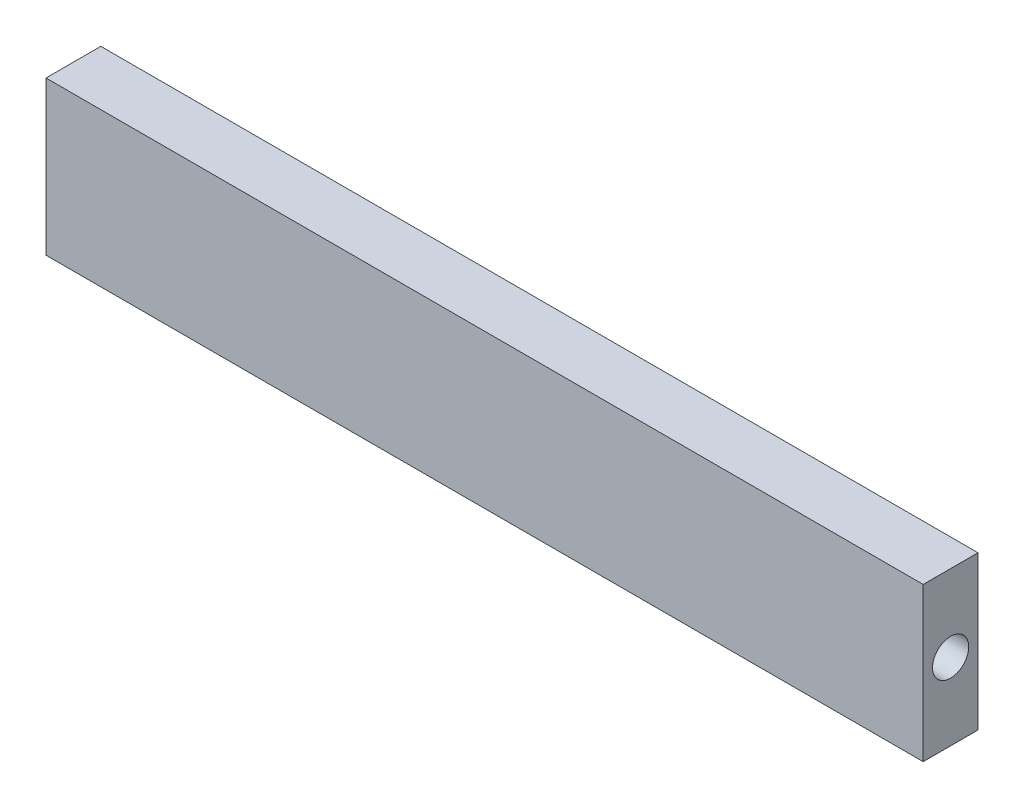
from build123d import *

# Parameters (mm, degrees)
SKETCH_1_W          = 400
SKETCH_1_H          = 70
EXTRUDE_1_DEPTH     = 25
SKETCH_2_R          = 8.25
CUT_EXTRUDE_1_DEPTH = 15
THREAD_1_PITCH      = 1.058333333
SKETCH_9_R          = 6
CUT_EXTRUDE_2_DEPTH = 15
CUT_EXTRUDE_START   = -15
SKETCH_10_R         = 8.25
SKETCH_10_R_2       = 6
CUT_EXTRUDE_3_DEPTH = 15
CUT_EXTRUDE_START_2 = -30
SKETCH_10_3_R       = 6
CUT_EXTRUDE_4_DEPTH = 15
CUT_EXTRUDE_START_3 = -4
CUT_EXTRUDE_6_DEPTH = 16


with BuildPart() as part:
    # Sketch 1 → 凸台-拉伸1 (new body)
    with BuildSketch(Plane.XY):
        with Locations((-140.998816655, -56.801018199)):
            Rectangle(SKETCH_1_W, SKETCH_1_H)
    extrude(amount=EXTRUDE_1_DEPTH)

    # Sketch 2 → 切除-拉伸1 (cut)
    with BuildSketch(Plane.ZY.offset(340.998816655)):
        with Locations(Location((12.5, -56.801018199, 0), (0, 0, 270))):
            Circle(SKETCH_2_R)
    extrude(amount=-CUT_EXTRUDE_1_DEPTH, mode=Mode.SUBTRACT)

    # 螺纹线1: the profile of Sketch 1 2 profile screwed along a right-hand helix of 14.173228 turns, 8 arcs to a turn; built about Z, then put on its axis
    thread_1_z = Axis((0, 0, 0), (0, 0, 1))
    thread_1_corners = [(8.2497, 0, -0.000173205), (8.822839718, 0, 0.330729165), (8.822839718, 0, 0.463020832), (8.2497, 0, 0.793923202)]
    with BuildLine(mode=Mode.PRIVATE) as thread_1_profile:
        Line(thread_1_corners[0], thread_1_corners[1])
        Line(thread_1_corners[1], thread_1_corners[2])
        Line(thread_1_corners[2], thread_1_corners[3])
        Line(thread_1_corners[3], thread_1_corners[0])
    thread_1_cap = Face(thread_1_profile.wire())
    thread_1_turn_angles = [0, 22.5, 45, 67.5, 90, 112.5, 135, 157.5, 180, 202.5, 225, 247.5, 270, 292.5, 315, 337.5, 360]
    thread_1_turn_weights = [1, 0.9238795325112867, 1, 0.9238795325112867, 1, 0.9238795325112867, 1, 0.9238795325112867, 1, 0.9238795325112867, 1, 0.9238795325112867, 1, 0.9238795325112867, 1, 0.9238795325112867, 1]
    thread_1_turn_rails = [Edge.make_bspline([Vector(p[0], p[1], 0).rotate(thread_1_z, thread_1_turn_angles[k]) / thread_1_turn_weights[k] + Vector(0, 0, p[2] + THREAD_1_PITCH * thread_1_turn_angles[k] / 360) for k in range(17)], [0, 0, 0, 1, 1, 2, 2, 3, 3, 4, 4, 5, 5, 6, 6, 7, 7, 8, 8, 8], 2, thread_1_turn_weights) for p in thread_1_corners]
    thread_1_turn_sides = [Face.make_surface_from_curves(thread_1_turn_rails[p[0]], thread_1_turn_rails[p[1]]) for p in [(0, 1), (1, 2), (2, 3), (3, 0)]]
    thread_1_last_angles = [5040, 5062.5, 5085, 5093.681102362, 5102.362204724]
    thread_1_last_weights = [1, 0.9238795325112867, 1, 0.9885437227923798, 1]
    thread_1_last_rails = [Edge.make_bspline([Vector(p[0], p[1], 0).rotate(thread_1_z, thread_1_last_angles[k]) / thread_1_last_weights[k] + Vector(0, 0, p[2] + THREAD_1_PITCH * thread_1_last_angles[k] / 360) for k in range(5)], [0, 0, 0, 1, 1, 2, 2, 2], 2, thread_1_last_weights) for p in thread_1_corners]
    thread_1_last_sides = [Face.make_surface_from_curves(thread_1_last_rails[p[0]], thread_1_last_rails[p[1]]) for p in [(0, 1), (1, 2), (2, 3), (3, 0)]]
    thread_1 = Plane(origin=(-325.998816655, -56.801018199, 12.5), x_dir=(0, 0, 1), z_dir=(-1, 0, 0)) * Solid(Shell([*[p.moved(Location((0, 0, THREAD_1_PITCH * i))) for i in range(14) for p in thread_1_turn_sides], *thread_1_last_sides, thread_1_cap, thread_1_cap.rotate(thread_1_z, 5102.362204724).moved(Location((0, 0, THREAD_1_PITCH * 5102.362204724 / 360)))]))
    add(thread_1, mode=Mode.SUBTRACT)

    # 草图9 → 切除-拉伸2 (cut)
    with BuildSketch(Plane.ZY.offset(325.998816655)):
        with Locations(Location((12.5, -56.801018199, 0), (0, 0, 270))):
            Circle(SKETCH_9_R)
    extrude(amount=-CUT_EXTRUDE_2_DEPTH, mode=Mode.SUBTRACT)

    # 草图10 → 切除-拉伸3 (cut)
    # profile 1 of 2: a face of its own
    with BuildSketch(Plane(origin=(59.001183345, 0, 0), x_dir=(0, 0, -1), z_dir=(1, 0, 0)).offset(CUT_EXTRUDE_START)):
        with Locations(Location((-12.5, -56.801018199, 0), (0, 0, 90))):
            Circle(SKETCH_10_R)
        with Locations(Location((-12.5, -56.801018199, 0), (0, 0, 270))):
            Circle(SKETCH_10_R_2, mode=Mode.SUBTRACT)
    # profile 2 of 2: a face of its own
    with BuildSketch(Plane(origin=(59.001183345, 0, 0), x_dir=(0, 0, -1), z_dir=(1, 0, 0)).offset(CUT_EXTRUDE_START)):
        with Locations(Location((-12.5, -56.801018199, 0), (0, 0, 270))):
            Circle(SKETCH_10_R_2)
    extrude(amount=CUT_EXTRUDE_3_DEPTH, mode=Mode.SUBTRACT)

    # 草图10<3> → 切除-拉伸4 (cut)
    with BuildSketch(Plane(origin=(59.001183345, 0, 0), x_dir=(0, 0, -1), z_dir=(1, 0, 0)).offset(CUT_EXTRUDE_START_2)):
        with Locations(Location((-12.5, -56.801018199, 0), (0, 0, 270))):
            Circle(SKETCH_10_3_R)
    extrude(amount=CUT_EXTRUDE_4_DEPTH, mode=Mode.SUBTRACT)

    # 草图13 → 切除-拉伸6 (cut)
    with BuildSketch(Plane.XY.offset(25).offset(CUT_EXTRUDE_START_3)):
        with BuildLine():
            Line((-302.998816655, -26.801018199), (-294.998816655, -26.801018199))
            Line((-294.998816655, -26.801018199), (-292.998816655, -26.801018199))
            Line((-292.998816655, -26.801018199), (-290.998816655, -26.801018199))
            Line((-290.998816655, -26.801018199), (-282.998816655, -26.801018199))
            ThreePointArc((-282.998816655, -26.801018199), (-277.341962405, -29.14416395), (-274.998816655, -34.801018199))
            Line((-274.998816655, -34.801018199), (-274.998816655, -78.801018199))
            Line((-274.998816655, -78.801018199), (-270.998816655, -78.801018199))
            Line((-270.998816655, -78.801018199), (-270.998816655, -34.801018199))
            ThreePointArc((-270.998816655, -34.801018199), (-268.655670904, -29.14416395), (-262.998816655, -26.801018199))
            Line((-262.998816655, -26.801018199), (-252.998816655, -26.801018199))
            Line((-252.998816655, -26.801018199), (-250.998816655, -26.801018199))
            Line((-250.998816655, -26.801018199), (-242.998816655, -26.801018199))
            ThreePointArc((-242.998816655, -26.801018199), (-237.341962405, -29.14416395), (-234.998816655, -34.801018199))
            Line((-234.998816655, -34.801018199), (-234.998816655, -78.801018199))
            Line((-234.998816655, -78.801018199), (-230.998816655, -78.801018199))
            Line((-230.998816655, -78.801018199), (-230.998816655, -34.801018199))
            ThreePointArc((-230.998816655, -34.801018199), (-228.655670904, -29.14416395), (-222.998816655, -26.801018199))
            Line((-222.998816655, -26.801018199), (-212.998816655, -26.801018199))
            Line((-212.998816655, -26.801018199), (-210.998816655, -26.801018199))
            Line((-210.998816655, -26.801018199), (-202.998816655, -26.801018199))
            ThreePointArc((-202.998816655, -26.801018199), (-197.341962405, -29.14416395), (-194.998816655, -34.801018199))
            Line((-194.998816655, -34.801018199), (-194.998816655, -78.801018199))
            Line((-194.998816655, -78.801018199), (-190.998816655, -78.801018199))
            Line((-190.998816655, -78.801018199), (-190.998816655, -34.801018199))
            ThreePointArc((-190.998816655, -34.801018199), (-188.655670904, -29.14416395), (-182.998816655, -26.801018199))
            Line((-182.998816655, -26.801018199), (-172.998816655, -26.801018199))
            Line((-172.998816655, -26.801018199), (-170.998816655, -26.801018199))
            Line((-170.998816655, -26.801018199), (-162.998816655, -26.801018199))
            ThreePointArc((-162.998816655, -26.801018199), (-157.341962405, -29.14416395), (-154.998816655, -34.801018199))
            Line((-154.998816655, -34.801018199), (-154.998816655, -78.801018199))
            Line((-154.998816655, -78.801018199), (-150.998816655, -78.801018199))
            Line((-150.998816655, -78.801018199), (-150.998816655, -34.801018199))
            ThreePointArc((-150.998816655, -34.801018199), (-148.655670904, -29.14416395), (-142.998816655, -26.801018199))
            Line((-142.998816655, -26.801018199), (-132.998816655, -26.801018199))
            Line((-132.998816655, -26.801018199), (-130.998816655, -26.801018199))
            Line((-130.998816655, -26.801018199), (-122.998816655, -26.801018199))
            ThreePointArc((-122.998816655, -26.801018199), (-117.341962405, -29.14416395), (-114.998816655, -34.801018199))
            Line((-114.998816655, -34.801018199), (-114.998816655, -78.801018199))
            Line((-114.998816655, -78.801018199), (-110.998816655, -78.801018199))
            Line((-110.998816655, -78.801018199), (-110.998816655, -34.801018199))
            ThreePointArc((-110.998816655, -34.801018199), (-108.655670904, -29.14416395), (-102.998816655, -26.801018199))
            Line((-102.998816655, -26.801018199), (-92.998816655, -26.801018199))
            Line((-92.998816655, -26.801018199), (-90.998816655, -26.801018199))
            Line((-90.998816655, -26.801018199), (-82.998816655, -26.801018199))
            ThreePointArc((-82.998816655, -26.801018199), (-77.341962405, -29.14416395), (-74.998816655, -34.801018199))
            Line((-74.998816655, -34.801018199), (-74.998816655, -78.801018199))
            Line((-74.998816655, -78.801018199), (-70.998816655, -78.801018199))
            Line((-70.998816655, -78.801018199), (-70.998816655, -34.801018199))
            ThreePointArc((-70.998816655, -34.801018199), (-68.655670904, -29.14416395), (-62.998816655, -26.801018199))
            Line((-62.998816655, -26.801018199), (-52.998816655, -26.801018199))
            Line((-52.998816655, -26.801018199), (-50.998816655, -26.801018199))
            Line((-50.998816655, -26.801018199), (-42.998816655, -26.801018199))
            ThreePointArc((-42.998816655, -26.801018199), (-37.341962405, -29.14416395), (-34.998816655, -34.801018199))
            Line((-34.998816655, -34.801018199), (-34.998816655, -78.801018199))
            Line((-34.998816655, -78.801018199), (-30.998816655, -78.801018199))
            Line((-30.998816655, -78.801018199), (-30.998816655, -34.801018199))
            ThreePointArc((-30.998816655, -34.801018199), (-28.655670904, -29.14416395), (-22.998816655, -26.801018199))
            Line((-22.998816655, -26.801018199), (-12.998816655, -26.801018199))
            Line((-12.998816655, -26.801018199), (-10.998816655, -26.801018199))
            Line((-10.998816655, -26.801018199), (-2.998816655, -26.801018199))
            ThreePointArc((-2.998816655, -26.801018199), (2.658037595, -29.14416395), (5.001183345, -34.801018199))
            Line((5.001183345, -34.801018199), (5.001183345, -78.801018199))
            Line((5.001183345, -78.801018199), (9.001183345, -78.801018199))
            Line((9.001183345, -78.801018199), (9.001183345, -34.801018199))
            ThreePointArc((9.001183345, -34.801018199), (11.344329096, -29.14416395), (17.001183345, -26.801018199))
            Line((17.001183345, -26.801018199), (21.001183345, -26.801018199))
            ThreePointArc((21.001183345, -26.801018199), (26.658037595, -29.14416395), (29.001183345, -34.801018199))
            Line((29.001183345, -34.801018199), (29.001183345, -78.801018199))
            ThreePointArc((29.001183345, -78.801018199), (26.658037595, -84.457872449), (21.001183345, -86.801018199))
            Line((21.001183345, -86.801018199), (-2.998816655, -86.801018199))
            ThreePointArc((-2.998816655, -86.801018199), (-8.655670904, -84.457872449), (-10.998816655, -78.801018199))
            Line((-10.998816655, -78.801018199), (-10.998816655, -34.801018199))
            Line((-10.998816655, -34.801018199), (-12.998816655, -34.801018199))
            Line((-12.998816655, -34.801018199), (-14.998816655, -34.801018199))
            Line((-14.998816655, -34.801018199), (-14.998816655, -78.801018199))
            ThreePointArc((-14.998816655, -78.801018199), (-17.341962405, -84.457872449), (-22.998816655, -86.801018199))
            Line((-22.998816655, -86.801018199), (-42.998816655, -86.801018199))
            ThreePointArc((-42.998816655, -86.801018199), (-48.655670904, -84.457872449), (-50.998816655, -78.801018199))
            Line((-50.998816655, -78.801018199), (-50.998816655, -34.801018199))
            Line((-50.998816655, -34.801018199), (-52.998816655, -34.801018199))
            Line((-52.998816655, -34.801018199), (-54.998816655, -34.801018199))
            Line((-54.998816655, -34.801018199), (-54.998816655, -78.801018199))
            ThreePointArc((-54.998816655, -78.801018199), (-57.341962405, -84.457872449), (-62.998816655, -86.801018199))
            Line((-62.998816655, -86.801018199), (-82.998816655, -86.801018199))
            ThreePointArc((-82.998816655, -86.801018199), (-88.655670904, -84.457872449), (-90.998816655, -78.801018199))
            Line((-90.998816655, -78.801018199), (-90.998816655, -34.801018199))
            Line((-90.998816655, -34.801018199), (-92.998816655, -34.801018199))
            Line((-92.998816655, -34.801018199), (-94.998816655, -34.801018199))
            Line((-94.998816655, -34.801018199), (-94.998816655, -78.801018199))
            ThreePointArc((-94.998816655, -78.801018199), (-97.341962405, -84.457872449), (-102.998816655, -86.801018199))
            Line((-102.998816655, -86.801018199), (-122.998816655, -86.801018199))
            ThreePointArc((-122.998816655, -86.801018199), (-128.655670904, -84.457872449), (-130.998816655, -78.801018199))
            Line((-130.998816655, -78.801018199), (-130.998816655, -34.801018199))
            Line((-130.998816655, -34.801018199), (-132.998816655, -34.801018199))
            Line((-132.998816655, -34.801018199), (-134.998816655, -34.801018199))
            Line((-134.998816655, -34.801018199), (-134.998816655, -78.801018199))
            ThreePointArc((-134.998816655, -78.801018199), (-137.341962405, -84.457872449), (-142.998816655, -86.801018199))
            Line((-142.998816655, -86.801018199), (-162.998816655, -86.801018199))
            ThreePointArc((-162.998816655, -86.801018199), (-168.655670904, -84.457872449), (-170.998816655, -78.801018199))
            Line((-170.998816655, -78.801018199), (-170.998816655, -34.801018199))
            Line((-170.998816655, -34.801018199), (-172.998816655, -34.801018199))
            Line((-172.998816655, -34.801018199), (-174.998816655, -34.801018199))
            Line((-174.998816655, -34.801018199), (-174.998816655, -78.801018199))
            ThreePointArc((-174.998816655, -78.801018199), (-177.341962405, -84.457872449), (-182.998816655, -86.801018199))
            Line((-182.998816655, -86.801018199), (-202.998816655, -86.801018199))
            ThreePointArc((-202.998816655, -86.801018199), (-208.655670904, -84.457872449), (-210.998816655, -78.801018199))
            Line((-210.998816655, -78.801018199), (-210.998816655, -34.801018199))
            Line((-210.998816655, -34.801018199), (-212.998816655, -34.801018199))
            Line((-212.998816655, -34.801018199), (-214.998816655, -34.801018199))
            Line((-214.998816655, -34.801018199), (-214.998816655, -78.801018199))
            ThreePointArc((-214.998816655, -78.801018199), (-217.341962405, -84.457872449), (-222.998816655, -86.801018199))
            Line((-222.998816655, -86.801018199), (-242.998816655, -86.801018199))
            ThreePointArc((-242.998816655, -86.801018199), (-248.655670904, -84.457872449), (-250.998816655, -78.801018199))
            Line((-250.998816655, -78.801018199), (-250.998816655, -34.801018199))
            Line((-250.998816655, -34.801018199), (-252.998816655, -34.801018199))
            Line((-252.998816655, -34.801018199), (-254.998816655, -34.801018199))
            Line((-254.998816655, -34.801018199), (-254.998816655, -78.801018199))
            ThreePointArc((-254.998816655, -78.801018199), (-257.341962405, -84.457872449), (-262.998816655, -86.801018199))
            Line((-262.998816655, -86.801018199), (-282.998816655, -86.801018199))
            ThreePointArc((-282.998816655, -86.801018199), (-288.655670904, -84.457872449), (-290.998816655, -78.801018199))
            Line((-290.998816655, -78.801018199), (-290.998816655, -34.801018199))
            Line((-290.998816655, -34.801018199), (-292.998816655, -34.801018199))
            Line((-292.998816655, -34.801018199), (-294.998816655, -34.801018199))
            Line((-294.998816655, -34.801018199), (-294.998816655, -78.801018199))
            ThreePointArc((-294.998816655, -78.801018199), (-302.998816655, -86.801018199), (-310.998816655, -78.801018199))
            Line((-310.998816655, -78.801018199), (-310.998816655, -34.801018199))
            ThreePointArc((-310.998816655, -34.801018199), (-308.655670904, -29.14416395), (-302.998816655, -26.801018199))
        make_face()
    extrude(amount=-CUT_EXTRUDE_6_DEPTH, mode=Mode.SUBTRACT)


solid = part.part
